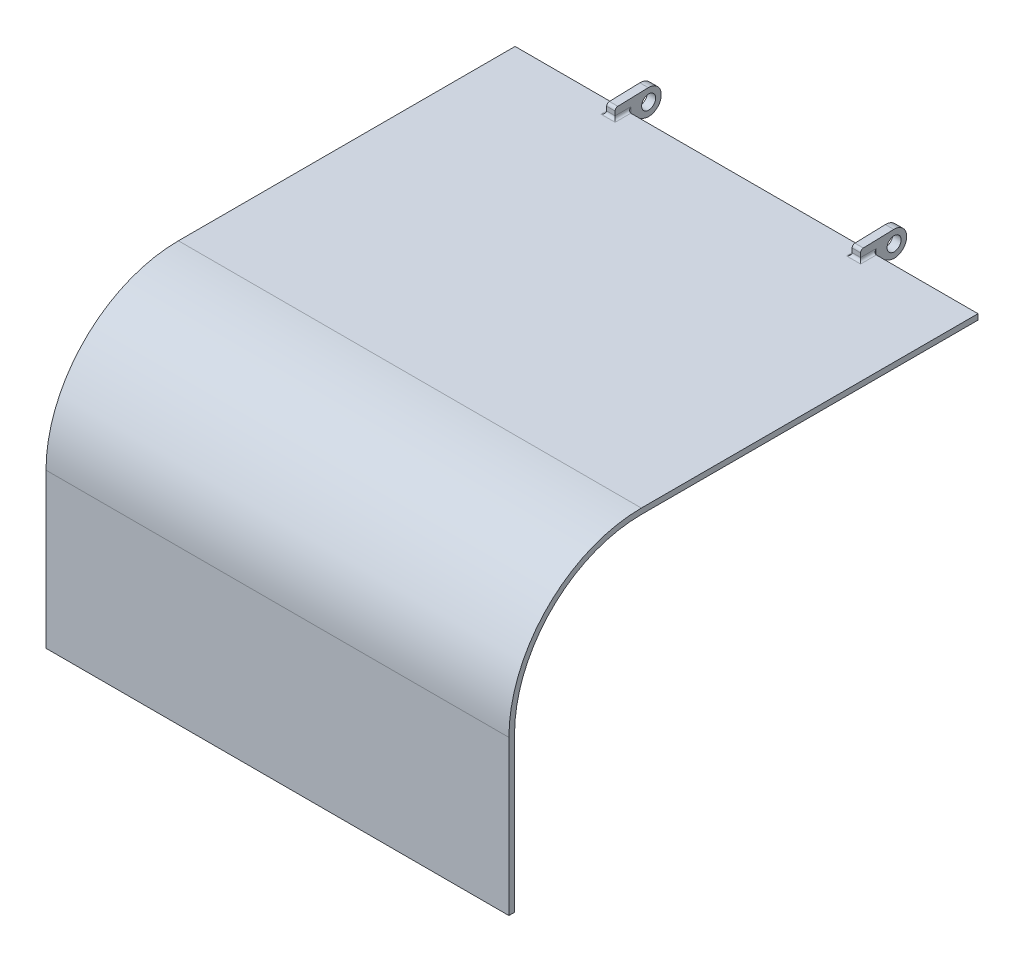
from build123d import *

# Parameters (mm, degrees)
BOSS_EXTRUDE1_DEPTH  = 82.5
SKETCH2_R            = 2.5
BOSS_EXTRUDE2_DEPTH  = 3
FILLET1_R            = 1
FILLET1_OF_MIRROR1_R = 1
BOSS_EXTRUDE3_DEPTH  = 25
FILLET2_SIZE         = 2
FILLET3_R            = 0.5


with BuildPart() as part:
    # Sketch1 → Boss-Extrude1 (new, symmetric)
    with BuildSketch(Plane(origin=(679.474882377, 899.436301878, 1292.844863494), x_dir=(0, 0, -1), z_dir=(1, 0, 0))):
        with BuildLine():
            Line((-167.2, 0), (-167.2, 55))
            ThreePointArc((-167.2, 55), (-153.375440072, 88.375440072), (-120, 102.2))
            Line((-120, 102.2), (0, 102.2))
            Line((0, 102.2), (0, 100.2))
            Line((0, 100.2), (-120, 100.2))
            ThreePointArc((-120, 100.2), (-151.96122651, 86.96122651), (-165.2, 55))
            Line((-165.2, 55), (-165.2, 0))
            Line((-165.2, 0), (-167.2, 0))
        make_face()
    extrude(amount=BOSS_EXTRUDE1_DEPTH, both=True)

    # Sketch2 → Boss-Extrude2 (add)
    with BuildSketch(Plane(origin=(721.724882377, 0, 0), x_dir=(0, 0, -1), z_dir=(1, 0, 0))):
        with BuildLine():
            Line((-1292.844863494, 999.636301878), (-1287.549744281, 996.914228228))
            ThreePointArc((-1287.549744281, 996.914228228), (-1281.103673423, 999.921643269), (-1285.623100176, 1005.414471007))
            Line((-1285.623100176, 1005.414471007), (-1297.448447634, 1005.070743882))
            Line((-1297.448447634, 1005.070743882), (-1297.448447634, 1001.636301878))
            Line((-1297.448447634, 1001.636301878), (-1292.844863494, 1001.636301878))
            Line((-1292.844863494, 1001.636301878), (-1292.844863494, 999.636301878))
        make_face()
        with Locations((-1285.492353992, 1000.916370804)):
            Circle(SKETCH2_R, mode=Mode.SUBTRACT)
    boss_extrude2 = extrude(amount=BOSS_EXTRUDE2_DEPTH)

    # Fillet1
    fillet1_edges = [part.edges().sort_by_distance(p)[0] for p in [
        (724.724882377, 1000.636301878, 1292.844863494),
        (724.724882377, 1001.636301878, 1295.146655564),
        (721.724882377, 1000.636301878, 1292.844863494),
        (723.224882377, 1005.070743882, 1297.448447634),
        (721.724882377, 1001.636301878, 1295.146655564),
        (723.224882377, 1001.636301878, 1297.448447634),
    ]]
    fillet(fillet1_edges, radius=FILLET1_R)

    # Mirror1: Boss-Extrude2 across plane
    add(boss_extrude2.mirror(Plane(origin=(679.474882377, 0, 0), x_dir=(0, 0, 1), z_dir=(1, 0, 0))))

    # Fillet1 of Mirror1
    fillet1_of_mirror1_edges = [part.edges().sort_by_distance(p)[0] for p in [
        (634.224882377, 1000.636301878, 1292.844863494),
        (634.224882377, 1001.636301878, 1295.146655564),
        (637.224882377, 1000.636301878, 1292.844863494),
        (635.724882377, 1005.070743882, 1297.448447634),
        (637.224882377, 1001.636301878, 1295.146655564),
        (635.724882377, 1001.636301878, 1297.448447634),
    ]]
    fillet(fillet1_of_mirror1_edges, radius=FILLET1_OF_MIRROR1_R)

    # Sketch3 → Boss-Extrude3 (add, symmetric)
    with BuildSketch(Plane(origin=(679.474882377, 0, 0), x_dir=(0, 0, -1), z_dir=(1, 0, 0))):
        with BuildLine():
            Line((-1458.044863494, 907.760575274), (-1456.444863494, 907.760575274))
            ThreePointArc((-1456.444863494, 907.760575274), (-1455.591310103, 908.114128665), (-1455.944863494, 907.260575274))
            Line((-1455.944863494, 907.260575274), (-1455.944863494, 904.260575274))
            Line((-1455.944863494, 904.260575274), (-1453.944863494, 904.260575274))
            Line((-1453.944863494, 904.260575274), (-1453.944863494, 909.760575274))
            Line((-1453.944863494, 909.760575274), (-1458.044863494, 909.760575274))
            Line((-1458.044863494, 909.760575274), (-1458.044863494, 907.760575274))
        make_face()
    extrude(amount=BOSS_EXTRUDE3_DEPTH, both=True)

    # Fillet2
    # a fillet whose section is not a circle: 2 mm, written as the material it takes off along each edge
    with BuildSketch(Plane(origin=(649.474882377, 904.260575274, 1455.944863494), x_dir=(0, 1, 0), z_dir=(1, 0, 0))) as fillet2_piece_1:
        with BuildLine():
            Bezier((FILLET2_SIZE, 0), (0, 0), (0, -FILLET2_SIZE), weights=[1, 0.538461538, 1])
            Line((0, -FILLET2_SIZE), (0, 0))
            Line((0, 0), (FILLET2_SIZE, 0))
        make_face()
    extrude(amount=60, mode=Mode.SUBTRACT)

    # Fillet3
    fillet3_edges = [part.edges().sort_by_distance(p)[0] for p in [
        (654.474882377, 907.010575274, 1453.944863494),
        (654.474882377, 909.760575274, 1455.994863494),
        (654.474882377, 908.760575274, 1458.044863494),
        (704.474882377, 908.760575274, 1458.044863494),
        (704.474882377, 909.760575274, 1455.994863494),
        (704.474882377, 907.010575274, 1453.944863494),
        (679.474882377, 909.760575274, 1458.044863494),
        (679.474882377, 909.760575274, 1453.944863494),
    ]]
    fillet(fillet3_edges, radius=FILLET3_R)


solid = part.part
